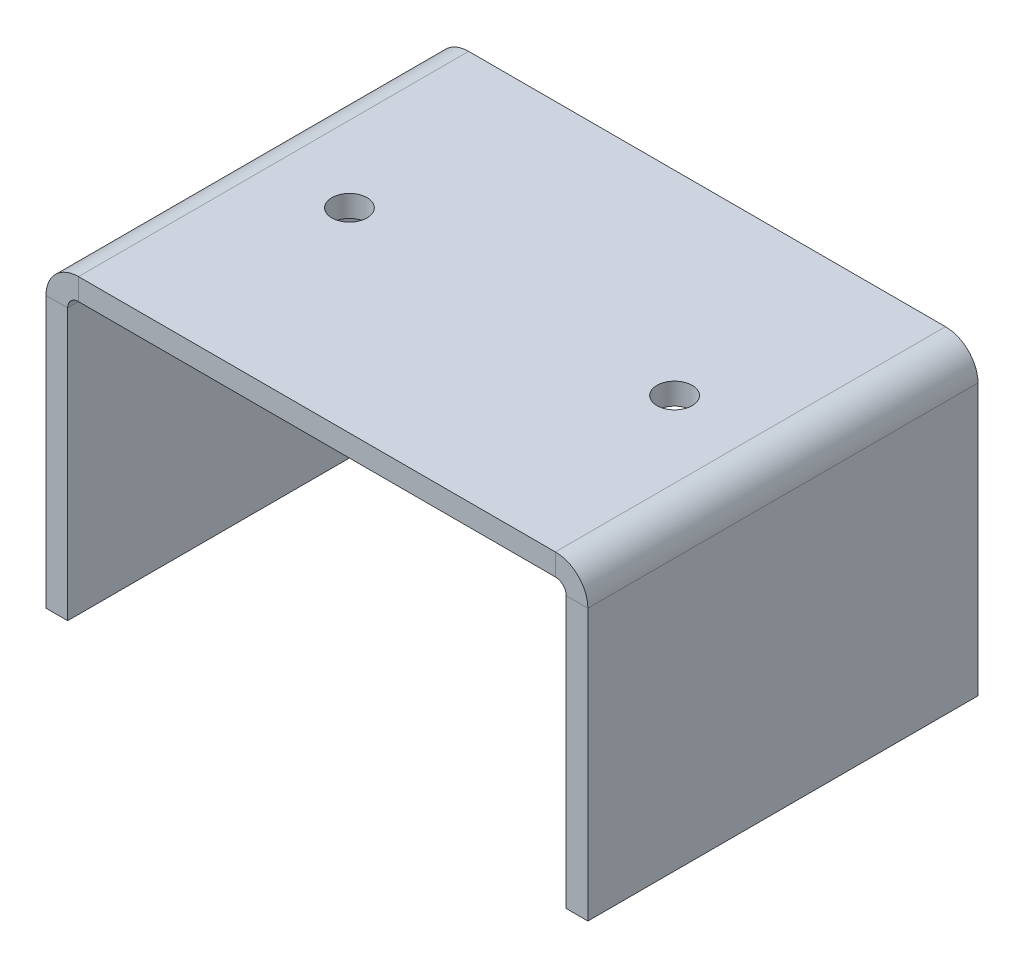
from build123d import *

# Parameters (mm, degrees)
EXTRUDE_THIN1_DEPTH        = 36
CONVERT_SOLID1_START       = -36
CONVERT_SOLID1_DEPTH       = 72
CONVERT_SOLID1_2_DEPTH     = 72
F_6_5_6_5_DIAMETER_HOLE1_D = 6.5
F_6_5_6_5_DIAMETER_HOLE2_D = 6.5


# Read off the part's stored shape, not the designer's step: Convert-Solid1
with BuildPart() as part:
    # Sketch1 → Extrude-Thin1 (new, symmetric)
    with BuildSketch(Plane.XY):
        Polygon((-50, -56), (-50, 0), (50, 0), (50, -56), (46, -56), (46, -4), (-46, -4), (-46, -56), align=None)
    extrude(amount=EXTRUDE_THIN1_DEPTH, both=True)

    # Convert-Solid1 outline → Convert-Solid1 (cut)
    with BuildSketch(Plane.XY.offset(CONVERT_SOLID1_START)):
        with BuildLine():
            Line((50, 0), (44, 0))
            ThreePointArc((44, 0), (48.242640687, -1.757359313), (50, -6))
            Line((50, -6), (50, 0))
        make_face()
        with BuildLine():
            ThreePointArc((-50, -6), (-48.242640687, -1.757359313), (-44, 0))
            Line((-44, 0), (-50, 0))
            Line((-50, 0), (-50, -6))
        make_face()
    extrude(amount=CONVERT_SOLID1_DEPTH, mode=Mode.SUBTRACT)

    # Convert-Solid1 2 outline → Convert-Solid1 2 (add)
    with BuildSketch(Plane.XY.offset(CONVERT_SOLID1_START)):
        with BuildLine():
            Line((46, -4), (44, -4))
            ThreePointArc((44, -4), (45.414213562, -4.585786438), (46, -6))
            Line((46, -6), (46, -4))
        make_face()
        with BuildLine():
            ThreePointArc((-46, -6), (-45.414213562, -4.585786438), (-44, -4))
            Line((-44, -4), (-46, -4))
            Line((-46, -4), (-46, -6))
        make_face()
    extrude(amount=CONVERT_SOLID1_2_DEPTH)

    # Ø6.5 (6.5) Diameter Hole1 (through all)
    with Locations(Plane(origin=(-92.5, 4, 244.5), x_dir=(1, 0, 0), z_dir=(0, 1, 0))):
        with Locations((-122.5, 244.5), (-62.5, 244.5), (62.5, 244.5), (122.5, 244.5)):
            Hole(F_6_5_6_5_DIAMETER_HOLE1_D / 2)

    # Ø6.5 (6.5) Diameter Hole2 (through all)
    with Locations(Plane(origin=(92.5, 4, 244.5), x_dir=(1, 0, 0), z_dir=(0, 1, 0))):
        with Locations((-122.5, 244.5), (-62.5, 244.5), (62.5, 244.5), (122.5, 244.5)):
            Hole(F_6_5_6_5_DIAMETER_HOLE2_D / 2)


solid = part.part
